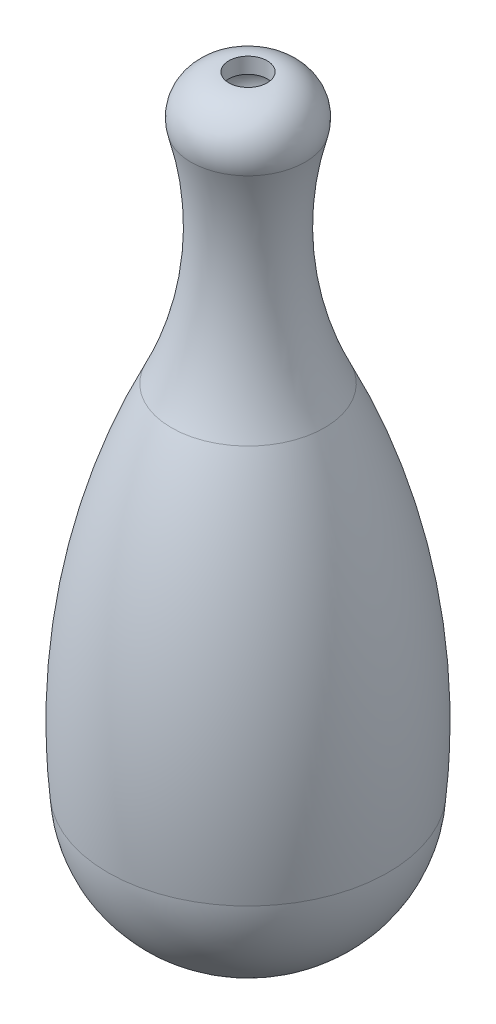
from build123d import *

# Parameters (mm, degrees)
FILLET2_R = 5


# Read off the part's stored shape, not the designer's step: Shell1
with BuildPart() as part:
    # Sketch1 → Revolve1 (revolve)
    with BuildSketch(Plane.XY, mode=Mode.PRIVATE) as revolve1_sk:
        with BuildLine():
            Line((0, -63.797140381), (0, 31.6188313))
            Line((0, 31.6188313), (9.599595572, 31.6188313))
            ThreePointArc((9.599595572, 31.6188313), (5.811218048, 14.425420045), (9.743674743, -2.735610786))
            ThreePointArc((9.743674743, -2.735610786), (16.822849649, -24.675666158), (17.829617097, -47.707538995))
            ThreePointArc((17.829617097, -47.707538995), (12.247074102, -59.444974295), (0, -63.797140381))
        make_face()
    revolve(revolve1_sk.sketch.rotate(Axis((0, 42.094887348, 0), (0, -1, 0)), 90), axis=Axis((0, 42.094887348, 0), (0, -1, 0)))

    # Fillet2
    fillet2_edges = [part.edges().sort_by_distance(p)[0] for p in [
        (0, 31.6188313, -9.599595572),
    ]]
    fillet(fillet2_edges, radius=FILLET2_R)

    # Shell1 outline → Shell1 (revolve, cut)
    with BuildSketch(Plane.XY):
        with BuildLine():
            add(Edge.make_bspline(
                [(0, -61.794158653), (0.171773273, -61.804150484), (0.344718213, -61.811736157), (0.518779812, -61.816853228), (0.693898025, -61.819440908), (1.179007679, -61.819440902), (1.491060471, -61.81147456), (1.80581642, -61.795227016), (2.122877878, -61.77040707), (6.438632362, -61.315115697), (10.933731114, -59.452200956), (14.214049157, -55.738643235), (15.649980468, -51.345795253), (15.83415592, -47.566841045)],
                knots=[4.654285736, 4.654285736, 4.654285736, 4.654285736, 4.654285736, 4.654285736, 4.71814981, 4.71814981, 4.71814981, 4.71814981, 4.830204647, 4.830204647, 4.830204647, 4.830204647, 6.234486692, 6.234486692, 6.234486692, 6.234486692, 6.234486692, 6.234486692], degree=5, weights=[1, 1, 1.000000035, 1.000000032, 1, 1, 1.000000159, 1.000000103, 1, 1, 0.975829822, 0.978630095, 1, 1]))
            ThreePointArc((15.83415592, -47.566841045), (14.857976157, -25.049414018), (7.939598929, -3.598924434))
            ThreePointArc((7.939598929, -3.598924434), (3.975279854, 10.874661112), (5.333427997, 25.819758566))
            ThreePointArc((5.333427997, 25.819758566), (4.828981104, 28.435804304), (2.441805137, 29.6188313))
            Line((2.441805137, 29.6188313), (2.441805137, 31.6188313))
            Line((2.441805137, 31.6188313), (0, 31.6188313))
            Line((0, 31.6188313), (0, -61.794158653))
        make_face()
    revolve(axis=Axis((0, 0, 0), (0, 1, 0)), mode=Mode.SUBTRACT)


solid = part.part
